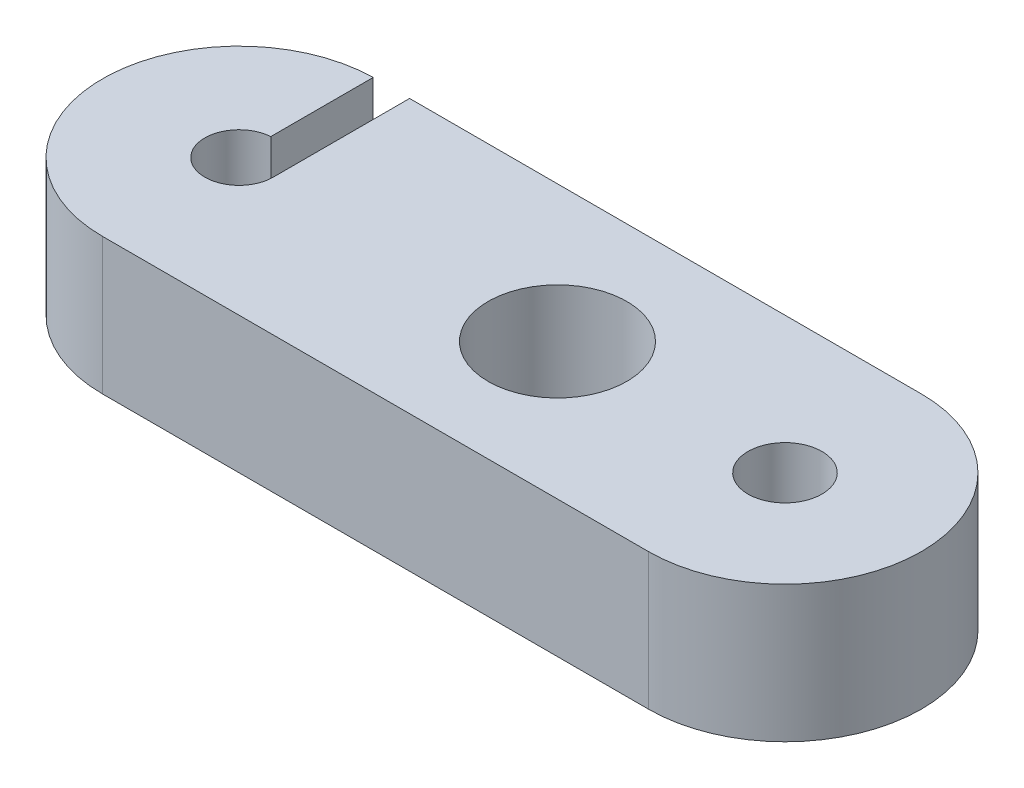
from build123d import *

# Parameters (mm, degrees)
SKETCH1_R           = 0.762
SKETCH1_R_2         = 0.4064
SKETCH1_R_3         = 0.375
BOSS_EXTRUDE1_DEPTH = 1.5
SKETCH2_W           = 0.4
SKETCH2_H           = 2.5
CUT_EXTRUDE1_DEPTH  = 5.974937186


with BuildPart() as part:
    # Sketch1 → Boss-Extrude1 (new body)
    with BuildSketch(Plane(origin=(0, 0, 0), x_dir=(1, 0, 0), z_dir=(0, 1, 0))):
        with BuildLine():
            Line((-3, 1.5), (3, 1.5))
            ThreePointArc((3, 1.5), (4.5, 0), (3, -1.5))
            Line((3, -1.5), (-3, -1.5))
            ThreePointArc((-3, -1.5), (-4.5, 0), (-3, 1.5))
        make_face()
        with Locations((0.5, 0)):
            Circle(SKETCH1_R, mode=Mode.SUBTRACT)
        with Locations((3, 0)):
            Circle(SKETCH1_R_2, mode=Mode.SUBTRACT)
        with Locations((-3, 0)):
            Circle(SKETCH1_R_3, mode=Mode.SUBTRACT)
    extrude(amount=BOSS_EXTRUDE1_DEPTH)

    # Sketch2 → Cut-Extrude1 (cut, through all)
    with BuildSketch(Plane.XZ):
        with Locations((-2.825, -1.25)):
            Rectangle(SKETCH2_W, SKETCH2_H)
    extrude(amount=-CUT_EXTRUDE1_DEPTH, mode=Mode.SUBTRACT)


solid = part.part
